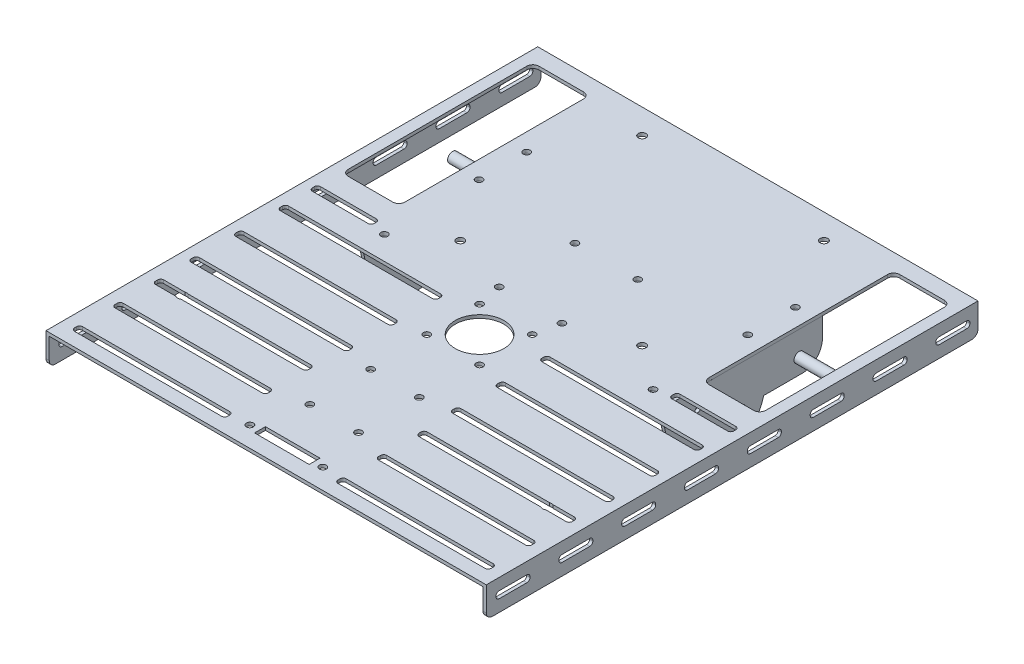
from build123d import *
from build123d.topology import SkipClean

# Parameters (mm, degrees)
SKETCH2_W                = 214
SKETCH2_H                = 242.598214609
SKETCH2_W_2              = 28
SKETCH2_H_2              = 94.123856443
BOSS_EXTRUDE1_DEPTH      = 1.6
BOSS_EXTRUDE3_DEPTH      = 1.6129
SKETCH6_R                = 1.27
SKETCH6_R_2              = 3
SKETCH6_R_3              = 2.55
BOSS_EXTRUDE4_DEPTH      = 1.6129
SKETCH7_R                = 1.7
SKETCH7_R_2              = 1.9
SKETCH7_R_3              = 2.25
SKETCH7_W                = 13.463625334
SKETCH7_H                = 5.356881788
CUT_EXTRUDE1_DEPTH       = 10
BOSS_EXTRUDE6_DEPTH      = 169
BOSS_EXTRUDE6_DEPTH_BACK = 21
SKETCH9_R                = 2.5
SKETCH11_W               = 1.6
SKETCH11_H               = 242.598214609
BOSS_EXTRUDE7_DEPTH      = 15
CUT_EXTRUDE2_DEPTH       = 8
CUT_EXTRUDE3_DEPTH       = 222
FILLET1_R                = 3


with BuildPart() as part:
    # Sketch2 → Boss-Extrude1 (new body)
    with BuildSketch(Plane(origin=(0, 0, 0), x_dir=(1, 0, 0), z_dir=(0, 1, 0))):
        with Locations((-65.266187111, 33.085004396)):
            Rectangle(SKETCH2_W, SKETCH2_H)
        with Locations((-154.266187111, 99.322183479)):
            Rectangle(SKETCH2_W_2, SKETCH2_H_2, mode=Mode.SUBTRACT)
        with Locations((23.733812889, 99.322183479)):
            Rectangle(SKETCH2_W_2, SKETCH2_H_2, mode=Mode.SUBTRACT)
    extrude(amount=BOSS_EXTRUDE1_DEPTH)


with BuildPart() as body_2:
    # Sketch4 → Boss-Extrude3 (new body)
    with BuildSketch(Plane.XZ):
        with BuildLine():
            Line((-140.267333078, -111.229721788), (-140.267333078, -31.67181992))
            Line((-140.267333078, -31.67181992), (-127.429884942, -31.67181992))
            ThreePointArc((-127.429884942, -31.67181992), (-123.894351036, -33.136286014), (-122.429884942, -36.67181992))
            Line((-122.429884942, -36.67181992), (-122.429884942, -60.433571732))
            Line((-122.429884942, -60.433571732), (-85.180673519, -60.433571732))
            Line((-85.180673519, -60.433571732), (-85.180673519, -37.931289086))
            Line((-85.180673519, -37.931289086), (-76.766187111, -37.931289086))
            Line((-76.766187111, -37.931289086), (-76.766187111, -84.232527977))
            Line((-76.766187111, -84.232527977), (-85.180673519, -84.232527977))
            Line((-85.180673519, -84.232527977), (-85.180673519, -67.120259162))
            Line((-85.180673519, -67.120259162), (-122.426749597, -67.120259162))
            Line((-122.426749597, -67.120259162), (-122.426749597, -106.229721788))
            ThreePointArc((-122.426749597, -106.229721788), (-123.891215691, -109.765255694), (-127.426749597, -111.229721788))
            Line((-127.426749597, -111.229721788), (-140.267333078, -111.229721788))
        make_face()
    extrude(amount=BOSS_EXTRUDE3_DEPTH)

    # Sketch6 → Boss-Extrude4 (add)
    with BuildSketch(Plane(origin=(-140.267333078, 113.834921078, 0), x_dir=(0, -1, 0), z_dir=(1, 0, 0))):
        with BuildLine():
            Line((113.834921078, 111.229721788), (113.834921078, 31.67181992))
            Line((113.834921078, 31.67181992), (115.447821078, 31.67181992))
            Line((115.447821078, 31.67181992), (132.436476957, 35.606170437))
            ThreePointArc((132.436476957, 35.606170437), (151.461048761, 58.546855783), (133.404101078, 82.256685324))
            Line((133.404101078, 82.256685324), (133.404101078, 101.229721788))
            ThreePointArc((133.404101078, 101.229721788), (130.47516889, 108.3007896), (123.404101078, 111.229721788))
            Line((123.404101078, 111.229721788), (113.834921078, 111.229721788))
        make_face()
        with Locations((133.404101078, 71.838631562)):
            Circle(SKETCH6_R, mode=Mode.SUBTRACT)
        with Locations((123.193301078, 49.664431562)):
            Circle(SKETCH6_R, mode=Mode.SUBTRACT)
        with Locations((133.404101078, 49.664431562)):
            Circle(SKETCH6_R_2, mode=Mode.SUBTRACT)
        with Locations((143.614901078, 49.664431562)):
            Circle(SKETCH6_R, mode=Mode.SUBTRACT)
        with Locations((125.834921078, 99.788179708)):
            Circle(SKETCH6_R_3, mode=Mode.SUBTRACT)
    extrude(amount=BOSS_EXTRUDE4_DEPTH)


with BuildPart() as cut_extrude1_tool:
    # Sketch7 → Cut-Extrude1 (new, symmetric)
    with BuildSketch(Plane.XZ):
        with Locations((-131.546259235, -83.109800249)):
            Circle(SKETCH7_R)
        with Locations((-131.546259235, -36.397683325)):
            Circle(SKETCH7_R)
        with Locations((-80.752061213, -42.21938946)):
            Circle(SKETCH7_R)
        with Locations((-80.752061213, -79.62237987)):
            Circle(SKETCH7_R)
        with Locations((-131.546259235, -106.617187947)):
            Circle(SKETCH7_R)
        with Locations((-110.116187111, -52.429944497)):
            Circle(SKETCH7_R_2)
        with Locations((-110.116187111, -142.129944497)):
            Circle(SKETCH7_R_2)
        with Locations((-155.266187111, 39.570055503)):
            Circle(SKETCH7_R_3)
        with Locations((-78.266187111, -4.079944497)):
            Circle(SKETCH7_R)
        with Locations((-78.266187111, -30.079944497)):
            Circle(SKETCH7_R)
        with Locations((-83.266187111, 78.214102909)):
            Circle(SKETCH7_R)
        with Locations((-77.266187111, 24.634898886)):
            Circle(SKETCH7_R)
        with Locations((-77.266187111, 54.634898886)):
            Circle(SKETCH7_R)
        with BuildLine():
            Line((-65.266187111, -5.079944497), (-65.266187111, -29.079944497))
            ThreePointArc((-65.266187111, -29.079944497), (-77.266187111, -17.079944497), (-65.266187111, -5.079944497))
        make_face()
        with Locations((-71.997999778, 77.779311165)):
            Rectangle(SKETCH7_W, SKETCH7_H)
    cut_extrude1 = extrude(amount=CUT_EXTRUDE1_DEPTH, both=True)


with BuildPart() as part_1:
    add(part.part)

    # Cut-Extrude1: cut by cut_extrude1_tool
    add(cut_extrude1_tool.part, mode=Mode.SUBTRACT)

    # Mirror2: Cut-Extrude1 across plane
    with SkipClean():  # the faces are left unmerged after this step: merging them gives an invalid solid
        add(cut_extrude1.mirror(Plane.ZY.offset(65.266187111)), mode=Mode.SUBTRACT)

    # Sketch11 → Boss-Extrude7 (add)
    with SkipClean():  # the faces are left unmerged after this step: merging them gives an invalid solid
        with BuildSketch(Plane(origin=(0, 1.6, 0), x_dir=(1, 0, 0), z_dir=(0, 1, 0))):
            with Locations((-173.066187111, 33.085004396)):
                Rectangle(SKETCH11_W, SKETCH11_H)
            with Locations((42.533812889, 33.085004396)):
                Rectangle(SKETCH11_W, SKETCH11_H)
        extrude(amount=-BOSS_EXTRUDE7_DEPTH)

    # Sketch12 → Cut-Extrude2 (cut)
    with SkipClean():  # the faces are left unmerged after this step: merging them gives an invalid solid
        with BuildSketch(Plane(origin=(0, 1.6, 0), x_dir=(1, 0, 0), z_dir=(0, 1, 0))):
            with BuildLine():
                Line((-167.284223867, 24.836229797), (-92.270296951, 24.836229797))
                ThreePointArc((-92.270296951, 24.836229797), (-91.209636779, 24.396889969), (-90.770296951, 23.336229797))
                Line((-90.770296951, 23.336229797), (-90.770296951, 22.336229797))
                ThreePointArc((-90.770296951, 22.336229797), (-91.209636779, 21.275569626), (-92.270296951, 20.836229797))
                Line((-92.270296951, 20.836229797), (-167.284223867, 20.836229797))
                ThreePointArc((-167.284223867, 20.836229797), (-168.344884038, 21.275569626), (-168.784223867, 22.336229797))
                Line((-168.784223867, 22.336229797), (-168.784223867, 23.336229797))
                ThreePointArc((-168.784223867, 23.336229797), (-168.344884038, 24.396889969), (-167.284223867, 24.836229797))
            make_face()
            with BuildLine():
                Line((-166.527658861, -37.474912082), (-93.977009275, -37.474912082))
                ThreePointArc((-93.977009275, -37.474912082), (-92.916349103, -37.91425191), (-92.477009275, -38.974912082))
                Line((-92.477009275, -38.974912082), (-92.477009275, -39.974912082))
                ThreePointArc((-92.477009275, -39.974912082), (-92.916349103, -41.035572254), (-93.977009275, -41.474912082))
                Line((-93.977009275, -41.474912082), (-166.527658861, -41.474912082))
                ThreePointArc((-166.527658861, -41.474912082), (-167.588319033, -41.035572254), (-168.027658861, -39.974912082))
                Line((-168.027658861, -39.974912082), (-168.027658861, -38.974912082))
                ThreePointArc((-168.027658861, -38.974912082), (-167.588319033, -37.91425191), (-166.527658861, -37.474912082))
            make_face()
            with BuildLine():
                Line((-167.284223867, -1.163770203), (-92.270296951, -1.163770203))
                ThreePointArc((-92.270296951, -1.163770203), (-91.209636779, -0.724430374), (-90.770296951, 0.336229797))
                Line((-90.770296951, 0.336229797), (-90.770296951, 1.336229797))
                ThreePointArc((-90.770296951, 1.336229797), (-91.209636779, 2.396889969), (-92.270296951, 2.836229797))
                Line((-92.270296951, 2.836229797), (-167.284223867, 2.836229797))
                ThreePointArc((-167.284223867, 2.836229797), (-168.344884038, 2.396889969), (-168.784223867, 1.336229797))
                Line((-168.784223867, 1.336229797), (-168.784223867, 0.336229797))
                ThreePointArc((-168.784223867, 0.336229797), (-168.344884038, -0.724430374), (-167.284223867, -1.163770203))
            make_face()
            with BuildLine():
                Line((-167.284223867, -23.163770203), (-92.270296951, -23.163770203))
                ThreePointArc((-92.270296951, -23.163770203), (-91.209636779, -22.724430374), (-90.770296951, -21.663770203))
                Line((-90.770296951, -21.663770203), (-90.770296951, -20.663770203))
                ThreePointArc((-90.770296951, -20.663770203), (-91.209636779, -19.603110031), (-92.270296951, -19.163770203))
                Line((-92.270296951, -19.163770203), (-167.284223867, -19.163770203))
                ThreePointArc((-167.284223867, -19.163770203), (-168.344884038, -19.603110031), (-168.784223867, -20.663770203))
                Line((-168.784223867, -20.663770203), (-168.784223867, -21.663770203))
                ThreePointArc((-168.784223867, -21.663770203), (-168.344884038, -22.724430374), (-167.284223867, -23.163770203))
            make_face()
            with BuildLine():
                Line((-166.527658861, -57.474912082), (-93.977009275, -57.474912082))
                ThreePointArc((-93.977009275, -57.474912082), (-92.916349103, -57.91425191), (-92.477009275, -58.974912082))
                Line((-92.477009275, -58.974912082), (-92.477009275, -59.974912082))
                ThreePointArc((-92.477009275, -59.974912082), (-92.916349103, -61.035572254), (-93.977009275, -61.474912082))
                Line((-93.977009275, -61.474912082), (-166.527658861, -61.474912082))
                ThreePointArc((-166.527658861, -61.474912082), (-167.588319033, -61.035572254), (-168.027658861, -59.974912082))
                Line((-168.027658861, -59.974912082), (-168.027658861, -58.974912082))
                ThreePointArc((-168.027658861, -58.974912082), (-167.588319033, -57.91425191), (-166.527658861, -57.474912082))
            make_face()
            with BuildLine():
                Line((-166.527658861, -77.474912082), (-93.977009275, -77.474912082))
                ThreePointArc((-93.977009275, -77.474912082), (-92.916349103, -77.91425191), (-92.477009275, -78.974912082))
                Line((-92.477009275, -78.974912082), (-92.477009275, -79.974912082))
                ThreePointArc((-92.477009275, -79.974912082), (-92.916349103, -81.035572254), (-93.977009275, -81.474912082))
                Line((-93.977009275, -81.474912082), (-166.527658861, -81.474912082))
                ThreePointArc((-166.527658861, -81.474912082), (-167.588319033, -81.035572254), (-168.027658861, -79.974912082))
                Line((-168.027658861, -79.974912082), (-168.027658861, -78.974912082))
                ThreePointArc((-168.027658861, -78.974912082), (-167.588319033, -77.91425191), (-166.527658861, -77.474912082))
            make_face()
            with BuildLine():
                Line((35.995284639, -81.474912082), (-36.555364947, -81.474912082))
                ThreePointArc((-36.555364947, -81.474912082), (-37.616025119, -81.035572254), (-38.055364947, -79.974912082))
                Line((-38.055364947, -79.974912082), (-38.055364947, -78.974912082))
                ThreePointArc((-38.055364947, -78.974912082), (-37.616025119, -77.91425191), (-36.555364947, -77.474912082))
                Line((-36.555364947, -77.474912082), (35.995284639, -77.474912082))
                ThreePointArc((35.995284639, -77.474912082), (37.055944811, -77.91425191), (37.495284639, -78.974912082))
                Line((37.495284639, -78.974912082), (37.495284639, -79.974912082))
                ThreePointArc((37.495284639, -79.974912082), (37.055944811, -81.035572254), (35.995284639, -81.474912082))
            make_face()
            with BuildLine():
                Line((35.995284639, -61.474912082), (-36.555364947, -61.474912082))
                ThreePointArc((-36.555364947, -61.474912082), (-37.616025119, -61.035572254), (-38.055364947, -59.974912082))
                Line((-38.055364947, -59.974912082), (-38.055364947, -58.974912082))
                ThreePointArc((-38.055364947, -58.974912082), (-37.616025119, -57.91425191), (-36.555364947, -57.474912082))
                Line((-36.555364947, -57.474912082), (35.995284639, -57.474912082))
                ThreePointArc((35.995284639, -57.474912082), (37.055944811, -57.91425191), (37.495284639, -58.974912082))
                Line((37.495284639, -58.974912082), (37.495284639, -59.974912082))
                ThreePointArc((37.495284639, -59.974912082), (37.055944811, -61.035572254), (35.995284639, -61.474912082))
            make_face()
            with BuildLine():
                Line((38.251849645, -20.663770203), (38.251849645, -21.663770203))
                ThreePointArc((38.251849645, -21.663770203), (37.812509817, -22.724430374), (36.751849645, -23.163770203))
                Line((36.751849645, -23.163770203), (-38.26207727, -23.163770203))
                ThreePointArc((-38.26207727, -23.163770203), (-39.322737442, -22.724430374), (-39.76207727, -21.663770203))
                Line((-39.76207727, -21.663770203), (-39.76207727, -20.663770203))
                ThreePointArc((-39.76207727, -20.663770203), (-39.322737442, -19.603110031), (-38.26207727, -19.163770203))
                Line((-38.26207727, -19.163770203), (36.751849645, -19.163770203))
                ThreePointArc((36.751849645, -19.163770203), (37.812509817, -19.603110031), (38.251849645, -20.663770203))
            make_face()
            with BuildLine():
                Line((38.251849645, 1.336229797), (38.251849645, 0.336229797))
                ThreePointArc((38.251849645, 0.336229797), (37.812509817, -0.724430374), (36.751849645, -1.163770203))
                Line((36.751849645, -1.163770203), (-38.26207727, -1.163770203))
                ThreePointArc((-38.26207727, -1.163770203), (-39.322737442, -0.724430374), (-39.76207727, 0.336229797))
                Line((-39.76207727, 0.336229797), (-39.76207727, 1.336229797))
                ThreePointArc((-39.76207727, 1.336229797), (-39.322737442, 2.396889969), (-38.26207727, 2.836229797))
                Line((-38.26207727, 2.836229797), (36.751849645, 2.836229797))
                ThreePointArc((36.751849645, 2.836229797), (37.812509817, 2.396889969), (38.251849645, 1.336229797))
            make_face()
            with BuildLine():
                Line((35.995284639, -41.474912082), (-36.555364947, -41.474912082))
                ThreePointArc((-36.555364947, -41.474912082), (-37.616025119, -41.035572254), (-38.055364947, -39.974912082))
                Line((-38.055364947, -39.974912082), (-38.055364947, -38.974912082))
                ThreePointArc((-38.055364947, -38.974912082), (-37.616025119, -37.91425191), (-36.555364947, -37.474912082))
                Line((-36.555364947, -37.474912082), (35.995284639, -37.474912082))
                ThreePointArc((35.995284639, -37.474912082), (37.055944811, -37.91425191), (37.495284639, -38.974912082))
                Line((37.495284639, -38.974912082), (37.495284639, -39.974912082))
                ThreePointArc((37.495284639, -39.974912082), (37.055944811, -41.035572254), (35.995284639, -41.474912082))
            make_face()
            with BuildLine():
                Line((36.751849645, 20.836229797), (-38.26207727, 20.836229797))
                ThreePointArc((-38.26207727, 20.836229797), (-39.322737442, 21.275569626), (-39.76207727, 22.336229797))
                Line((-39.76207727, 22.336229797), (-39.76207727, 23.336229797))
                ThreePointArc((-39.76207727, 23.336229797), (-39.322737442, 24.396889969), (-38.26207727, 24.836229797))
                Line((-38.26207727, 24.836229797), (36.751849645, 24.836229797))
                ThreePointArc((36.751849645, 24.836229797), (37.812509817, 24.396889969), (38.251849645, 23.336229797))
                Line((38.251849645, 23.336229797), (38.251849645, 22.336229797))
                ThreePointArc((38.251849645, 22.336229797), (37.812509817, 21.275569626), (36.751849645, 20.836229797))
            make_face()
            with BuildLine():
                Line((-167.695756368, 41.035820187), (-140.216996423, 41.035820187))
                ThreePointArc((-140.216996423, 41.035820187), (-139.156336251, 40.596480358), (-138.716996423, 39.535820187))
                Line((-138.716996423, 39.535820187), (-138.716996423, 38.535820187))
                ThreePointArc((-138.716996423, 38.535820187), (-139.156336251, 37.475160015), (-140.216996423, 37.035820187))
                Line((-140.216996423, 37.035820187), (-167.695756368, 37.035820187))
                ThreePointArc((-167.695756368, 37.035820187), (-168.75641654, 37.475160015), (-169.195756368, 38.535820187))
                Line((-169.195756368, 38.535820187), (-169.195756368, 39.535820187))
                ThreePointArc((-169.195756368, 39.535820187), (-168.75641654, 40.596480358), (-167.695756368, 41.035820187))
            make_face()
            with BuildLine():
                Line((38.663382146, 39.535820187), (38.663382146, 38.535820187))
                ThreePointArc((38.663382146, 38.535820187), (38.224042318, 37.475160015), (37.163382146, 37.035820187))
                Line((37.163382146, 37.035820187), (9.684622202, 37.035820187))
                ThreePointArc((9.684622202, 37.035820187), (8.62396203, 37.475160015), (8.184622202, 38.535820187))
                Line((8.184622202, 38.535820187), (8.184622202, 39.535820187))
                ThreePointArc((8.184622202, 39.535820187), (8.62396203, 40.596480358), (9.684622202, 41.035820187))
                Line((9.684622202, 41.035820187), (37.163382146, 41.035820187))
                ThreePointArc((37.163382146, 41.035820187), (38.224042318, 40.596480358), (38.663382146, 39.535820187))
            make_face()
        extrude(amount=-CUT_EXTRUDE2_DEPTH, mode=Mode.SUBTRACT)

    # Sketch13 → Cut-Extrude3 (cut)
    with SkipClean():  # the faces are left unmerged after this step: merging them gives an invalid solid
        with BuildSketch(Plane.ZY.offset(173.866187111)):
            with BuildLine():
                Line((-148.857825312, -4.111400281), (-135.10457725, -4.111400281))
                ThreePointArc((-135.10457725, -4.111400281), (-134.043917078, -4.550740109), (-133.60457725, -5.611400281))
                Line((-133.60457725, -5.611400281), (-133.60457725, -6.011400281))
                ThreePointArc((-133.60457725, -6.011400281), (-134.043917078, -7.072060453), (-135.10457725, -7.511400281))
                Line((-135.10457725, -7.511400281), (-148.857825312, -7.511400281))
                ThreePointArc((-148.857825312, -7.511400281), (-149.918485484, -7.072060453), (-150.357825312, -6.011400281))
                Line((-150.357825312, -6.011400281), (-150.357825312, -5.611400281))
                ThreePointArc((-150.357825312, -5.611400281), (-149.918485484, -4.550740109), (-148.857825312, -4.111400281))
            make_face()
            with BuildLine():
                Line((-102.60457725, -5.611400281), (-102.60457725, -6.011400281))
                ThreePointArc((-102.60457725, -6.011400281), (-103.043917078, -7.072060453), (-104.10457725, -7.511400281))
                Line((-104.10457725, -7.511400281), (-117.857825312, -7.511400281))
                ThreePointArc((-117.857825312, -7.511400281), (-118.918485484, -7.072060453), (-119.357825312, -6.011400281))
                Line((-119.357825312, -6.011400281), (-119.357825312, -5.611400281))
                ThreePointArc((-119.357825312, -5.611400281), (-118.918485484, -4.550740109), (-117.857825312, -4.111400281))
                Line((-117.857825312, -4.111400281), (-104.10457725, -4.111400281))
                ThreePointArc((-104.10457725, -4.111400281), (-103.043917078, -4.550740109), (-102.60457725, -5.611400281))
            make_face()
            with BuildLine():
                Line((-71.60457725, -5.611400281), (-71.60457725, -6.011400281))
                ThreePointArc((-71.60457725, -6.011400281), (-72.043917078, -7.072060453), (-73.10457725, -7.511400281))
                Line((-73.10457725, -7.511400281), (-86.857825312, -7.511400281))
                ThreePointArc((-86.857825312, -7.511400281), (-87.918485484, -7.072060453), (-88.357825312, -6.011400281))
                Line((-88.357825312, -6.011400281), (-88.357825312, -5.611400281))
                ThreePointArc((-88.357825312, -5.611400281), (-87.918485484, -4.550740109), (-86.857825312, -4.111400281))
                Line((-86.857825312, -4.111400281), (-73.10457725, -4.111400281))
                ThreePointArc((-73.10457725, -4.111400281), (-72.043917078, -4.550740109), (-71.60457725, -5.611400281))
            make_face()
            with BuildLine():
                Line((-40.60457725, -5.611400281), (-40.60457725, -6.011400281))
                ThreePointArc((-40.60457725, -6.011400281), (-41.043917078, -7.072060453), (-42.10457725, -7.511400281))
                Line((-42.10457725, -7.511400281), (-55.857825312, -7.511400281))
                ThreePointArc((-55.857825312, -7.511400281), (-56.918485484, -7.072060453), (-57.357825312, -6.011400281))
                Line((-57.357825312, -6.011400281), (-57.357825312, -5.611400281))
                ThreePointArc((-57.357825312, -5.611400281), (-56.918485484, -4.550740109), (-55.857825312, -4.111400281))
                Line((-55.857825312, -4.111400281), (-42.10457725, -4.111400281))
                ThreePointArc((-42.10457725, -4.111400281), (-41.043917078, -4.550740109), (-40.60457725, -5.611400281))
            make_face()
            with BuildLine():
                Line((-9.60457725, -5.611400281), (-9.60457725, -6.011400281))
                ThreePointArc((-9.60457725, -6.011400281), (-10.043917078, -7.072060453), (-11.10457725, -7.511400281))
                Line((-11.10457725, -7.511400281), (-24.857825312, -7.511400281))
                ThreePointArc((-24.857825312, -7.511400281), (-25.918485484, -7.072060453), (-26.357825312, -6.011400281))
                Line((-26.357825312, -6.011400281), (-26.357825312, -5.611400281))
                ThreePointArc((-26.357825312, -5.611400281), (-25.918485484, -4.550740109), (-24.857825312, -4.111400281))
                Line((-24.857825312, -4.111400281), (-11.10457725, -4.111400281))
                ThreePointArc((-11.10457725, -4.111400281), (-10.043917078, -4.550740109), (-9.60457725, -5.611400281))
            make_face()
            with BuildLine():
                Line((21.39542275, -5.611400281), (21.39542275, -6.011400281))
                ThreePointArc((21.39542275, -6.011400281), (20.956082922, -7.072060453), (19.89542275, -7.511400281))
                Line((19.89542275, -7.511400281), (6.142174688, -7.511400281))
                ThreePointArc((6.142174688, -7.511400281), (5.081514516, -7.072060453), (4.642174688, -6.011400281))
                Line((4.642174688, -6.011400281), (4.642174688, -5.611400281))
                ThreePointArc((4.642174688, -5.611400281), (5.081514516, -4.550740109), (6.142174688, -4.111400281))
                Line((6.142174688, -4.111400281), (19.89542275, -4.111400281))
                ThreePointArc((19.89542275, -4.111400281), (20.956082922, -4.550740109), (21.39542275, -5.611400281))
            make_face()
            with BuildLine():
                Line((52.39542275, -5.611400281), (52.39542275, -6.011400281))
                ThreePointArc((52.39542275, -6.011400281), (51.956082922, -7.072060453), (50.89542275, -7.511400281))
                Line((50.89542275, -7.511400281), (37.142174688, -7.511400281))
                ThreePointArc((37.142174688, -7.511400281), (36.081514516, -7.072060453), (35.642174688, -6.011400281))
                Line((35.642174688, -6.011400281), (35.642174688, -5.611400281))
                ThreePointArc((35.642174688, -5.611400281), (36.081514516, -4.550740109), (37.142174688, -4.111400281))
                Line((37.142174688, -4.111400281), (50.89542275, -4.111400281))
                ThreePointArc((50.89542275, -4.111400281), (51.956082922, -4.550740109), (52.39542275, -5.611400281))
            make_face()
            with BuildLine():
                Line((83.39542275, -5.611400281), (83.39542275, -6.011400281))
                ThreePointArc((83.39542275, -6.011400281), (82.956082922, -7.072060453), (81.89542275, -7.511400281))
                Line((81.89542275, -7.511400281), (68.142174688, -7.511400281))
                ThreePointArc((68.142174688, -7.511400281), (67.081514516, -7.072060453), (66.642174688, -6.011400281))
                Line((66.642174688, -6.011400281), (66.642174688, -5.611400281))
                ThreePointArc((66.642174688, -5.611400281), (67.081514516, -4.550740109), (68.142174688, -4.111400281))
                Line((68.142174688, -4.111400281), (81.89542275, -4.111400281))
                ThreePointArc((81.89542275, -4.111400281), (82.956082922, -4.550740109), (83.39542275, -5.611400281))
            make_face()
        extrude(amount=-CUT_EXTRUDE3_DEPTH, mode=Mode.SUBTRACT)

    # Fillet1
    fillet1_edges = [part_1.edges().sort_by_distance(p)[0] for p in [
        (-173.066187111, -13.4, 88.214102909),
        (-173.066187111, -13.4, -154.3841117),
        (42.533812889, -13.4, -154.3841117),
        (42.533812889, -13.4, 88.214102909),
        (-140.266187111, 0.8, -52.260255257),
        (-168.266187111, 0.8, -146.3841117),
        (-168.266187111, 0.8, -52.260255257),
        (-140.266187111, 0.8, -146.3841117),
        (37.733812889, 0.8, -146.3841117),
        (9.733812889, 0.8, -146.3841117),
        (37.733812889, 0.8, -52.260255257),
        (9.733812889, 0.8, -52.260255257),
    ]]
    fillet(fillet1_edges, radius=FILLET1_R)


with BuildPart() as body_2_1:
    add(body_2.part)

    # Cut-Extrude1: cut by cut_extrude1_tool
    add(cut_extrude1_tool.part, mode=Mode.SUBTRACT)


with BuildPart() as body_3:
    # Mirror1: mirrored copy
    add(body_2_1.part.mirror(Plane.ZY.offset(65.266187111)))


with BuildPart() as body_4:
    # Sketch9 → Boss-Extrude6 (new, two sides: drawn at the far end of the back side and taken through both)
    with BuildSketch(Plane(origin=(-140.266187111, 0, 0), x_dir=(0, 0, -1), z_dir=(1, 0, 0)).offset(-BOSS_EXTRUDE6_DEPTH_BACK)):
        with Locations((99.788179708, -12)):
            Circle(SKETCH9_R)
    extrude(amount=BOSS_EXTRUDE6_DEPTH + BOSS_EXTRUDE6_DEPTH_BACK)


solid = Compound([part_1.part, body_2_1.part, body_3.part, body_4.part])
